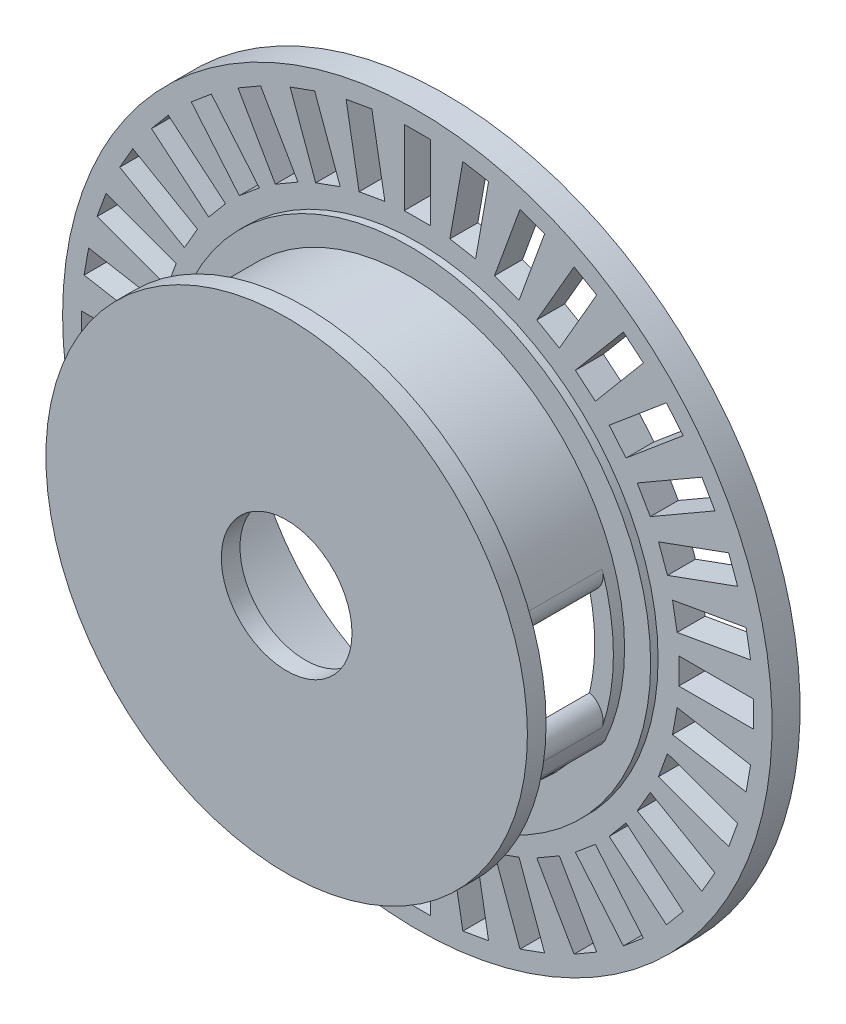
from build123d import *

# Parameters (mm, degrees)
SKETCH1_R               = 19
SKETCH1_R_2             = 3.4
SKETCH1_W               = 1.4
SKETCH1_H               = 4
SKETCH1_W_2             = 4
SKETCH1_H_2             = 1.4
BOSS_EXTRUDE1_DEPTH     = 1.5
SKETCH3_R               = 11.5
SKETCH3_R_2             = 3.4
BOSS_EXTRUDE3_DEPTH     = 1
BOSS_EXTRUDE4_DEPTH     = 6
CUT_EXTRUDE1_DEPTH      = 5
FILLET1_R               = 1
CUT_EXTRUDE2_DEPTH      = 4
CUT_EXTRUDE2_DEPTH_BACK = 22
SKETCH6_R               = 0.75
FILLET2_R               = 1
SKETCH10_W              = 2
SKETCH10_H              = 1
SKETCH15_R              = 10.5
CUT_EXTRUDE8_DEPTH      = 20
SKETCH16_R              = 19
CUT_EXTRUDE9_DEPTH      = 12.2
SKETCH18_W              = 4.7
SKETCH18_H              = 4.8
SKETCH18_W_2            = 4.9999
SKETCH18_H_2            = 1.857328015
CUT_EXTRUDE10_DEPTH     = 18
SKETCH20_R              = 12.8947325
SKETCH20_R_2            = 3.5
BOSS_EXTRUDE5_DEPTH     = 1


with BuildPart() as part:
    # Sketch1 → Boss-Extrude1 (new body)
    with BuildSketch(Plane.XY):
        Circle(SKETCH1_R)
        Circle(SKETCH1_R_2, mode=Mode.SUBTRACT)
        Polygon((3.120439914, 13.665754818), (1.74170906, 13.908862267), (2.436301771, 17.848093279), (3.815032625, 17.60498583), align=None, mode=Mode.SUBTRACT)
        with Locations((0, 16)):
            Rectangle(SKETCH1_W, SKETCH1_H, mode=Mode.SUBTRACT)
        Polygon((5.446066841, 12.916282591), (4.130497172, 13.395110791), (5.498577745, 17.153881274), (6.814147414, 16.675053074), align=None, mode=Mode.SUBTRACT)
        Polygon((7.606217783, 11.774355653), (6.393782217, 12.474355653), (8.393782217, 15.938457268), (9.606217783, 15.238457268), align=None, mode=Mode.SUBTRACT)
        Polygon((9.535257646, 10.274670877), (8.462795425, 11.17457353), (11.033945864, 14.238751303), (12.106408085, 13.338848649), align=None, mode=Mode.SUBTRACT)
        Polygon((11.17457353, 8.462795425), (10.274670877, 9.535257646), (13.338848649, 12.106408085), (14.238751303, 11.033945864), align=None, mode=Mode.SUBTRACT)
        Polygon((12.474355653, 6.393782217), (11.774355653, 7.606217783), (15.238457268, 9.606217783), (15.938457268, 8.393782217), align=None, mode=Mode.SUBTRACT)
        Polygon((13.395110791, 4.130497172), (12.916282591, 5.446066841), (16.675053074, 6.814147414), (17.153881274, 5.498577745), align=None, mode=Mode.SUBTRACT)
        Polygon((13.908862267, 1.74170906), (13.665754818, 3.120439914), (17.60498583, 3.815032625), (17.848093279, 2.436301771), align=None, mode=Mode.SUBTRACT)
        with Locations((16, 0)):
            Rectangle(SKETCH1_W_2, SKETCH1_H_2, mode=Mode.SUBTRACT)
        Polygon((13.665754818, -3.120439914), (13.908862267, -1.74170906), (17.848093279, -2.436301771), (17.60498583, -3.815032625), align=None, mode=Mode.SUBTRACT)
        Polygon((12.916282591, -5.446066841), (13.395110791, -4.130497172), (17.153881274, -5.498577745), (16.675053074, -6.814147414), align=None, mode=Mode.SUBTRACT)
        Polygon((11.774355653, -7.606217783), (12.474355653, -6.393782217), (15.938457268, -8.393782217), (15.238457268, -9.606217783), align=None, mode=Mode.SUBTRACT)
        Polygon((10.274670877, -9.535257646), (11.17457353, -8.462795425), (14.238751303, -11.033945864), (13.338848649, -12.106408085), align=None, mode=Mode.SUBTRACT)
        Polygon((8.462795425, -11.17457353), (9.535257646, -10.274670877), (12.106408085, -13.338848649), (11.033945864, -14.238751303), align=None, mode=Mode.SUBTRACT)
        Polygon((6.393782217, -12.474355653), (7.606217783, -11.774355653), (9.606217783, -15.238457268), (8.393782217, -15.938457268), align=None, mode=Mode.SUBTRACT)
        Polygon((4.130497172, -13.395110791), (5.446066841, -12.916282591), (6.814147414, -16.675053074), (5.498577745, -17.153881274), align=None, mode=Mode.SUBTRACT)
        Polygon((1.74170906, -13.908862267), (3.120439914, -13.665754818), (3.815032625, -17.60498583), (2.436301771, -17.848093279), align=None, mode=Mode.SUBTRACT)
        with Locations((0, -16)):
            Rectangle(SKETCH1_W, SKETCH1_H, mode=Mode.SUBTRACT)
        Polygon((-3.120439914, -13.665754818), (-1.74170906, -13.908862267), (-2.436301771, -17.848093279), (-3.815032625, -17.60498583), align=None, mode=Mode.SUBTRACT)
        Polygon((-5.446066841, -12.916282591), (-4.130497172, -13.395110791), (-5.498577745, -17.153881274), (-6.814147414, -16.675053074), align=None, mode=Mode.SUBTRACT)
        Polygon((-7.606217783, -11.774355653), (-6.393782217, -12.474355653), (-8.393782217, -15.938457268), (-9.606217783, -15.238457268), align=None, mode=Mode.SUBTRACT)
        Polygon((-9.535257646, -10.274670877), (-8.462795425, -11.17457353), (-11.033945864, -14.238751303), (-12.106408085, -13.338848649), align=None, mode=Mode.SUBTRACT)
        Polygon((-11.17457353, -8.462795425), (-10.274670877, -9.535257646), (-13.338848649, -12.106408085), (-14.238751303, -11.033945864), align=None, mode=Mode.SUBTRACT)
        Polygon((-12.474355653, -6.393782217), (-11.774355653, -7.606217783), (-15.238457268, -9.606217783), (-15.938457268, -8.393782217), align=None, mode=Mode.SUBTRACT)
        Polygon((-13.395110791, -4.130497172), (-12.916282591, -5.446066841), (-16.675053074, -6.814147414), (-17.153881274, -5.498577745), align=None, mode=Mode.SUBTRACT)
        Polygon((-13.908862267, -1.74170906), (-13.665754818, -3.120439914), (-17.60498583, -3.815032625), (-17.848093279, -2.436301771), align=None, mode=Mode.SUBTRACT)
        with Locations((-16, 0)):
            Rectangle(SKETCH1_W_2, SKETCH1_H_2, mode=Mode.SUBTRACT)
        Polygon((-13.665754818, 3.120439914), (-13.908862267, 1.74170906), (-17.848093279, 2.436301771), (-17.60498583, 3.815032625), align=None, mode=Mode.SUBTRACT)
        Polygon((-12.916282591, 5.446066841), (-13.395110791, 4.130497172), (-17.153881274, 5.498577745), (-16.675053074, 6.814147414), align=None, mode=Mode.SUBTRACT)
        Polygon((-11.774355653, 7.606217783), (-12.474355653, 6.393782217), (-15.938457268, 8.393782217), (-15.238457268, 9.606217783), align=None, mode=Mode.SUBTRACT)
        Polygon((-10.274670877, 9.535257646), (-11.17457353, 8.462795425), (-14.238751303, 11.033945864), (-13.338848649, 12.106408085), align=None, mode=Mode.SUBTRACT)
        Polygon((-8.462795425, 11.17457353), (-9.535257646, 10.274670877), (-12.106408085, 13.338848649), (-11.033945864, 14.238751303), align=None, mode=Mode.SUBTRACT)
        Polygon((-6.393782217, 12.474355653), (-7.606217783, 11.774355653), (-9.606217783, 15.238457268), (-8.393782217, 15.938457268), align=None, mode=Mode.SUBTRACT)
        Polygon((-4.130497172, 13.395110791), (-5.446066841, 12.916282591), (-6.814147414, 16.675053074), (-5.498577745, 17.153881274), align=None, mode=Mode.SUBTRACT)
        Polygon((-1.74170906, 13.908862267), (-3.120439914, 13.665754818), (-3.815032625, 17.60498583), (-2.436301771, 17.848093279), align=None, mode=Mode.SUBTRACT)
    extrude(amount=BOSS_EXTRUDE1_DEPTH)

    # Sketch3 → Boss-Extrude3 (add)
    with BuildSketch(Plane.XY.offset(1.5)):
        Circle(SKETCH3_R)
        Circle(SKETCH3_R_2, mode=Mode.SUBTRACT)
    extrude(amount=BOSS_EXTRUDE3_DEPTH)

    # Sketch4 → Boss-Extrude4 (add)
    with BuildSketch(Plane.XY.offset(2.5)):
        with BuildLine():
            Line((11.246777316, -2.4), (10.222035022, -2.4))
            ThreePointArc((10.222035022, -2.4), (-10.5, 0), (10.222035022, 2.4))
            Line((10.222035022, 2.4), (11.246777316, 2.4))
            ThreePointArc((11.246777316, 2.4), (-11.5, 0), (11.246777316, -2.4))
        make_face()
    extrude(amount=BOSS_EXTRUDE4_DEPTH)

    # Sketch5 → Cut-Extrude1 (cut)
    with BuildSketch(Plane.XY.offset(1.5)):
        with BuildLine():
            Line((11.691342951, -6.75), (9.09326674, -5.25))
            ThreePointArc((9.09326674, -5.25), (6.62136247, -8.149083325), (3.277720856, -9.975296787))
            Line((3.277720856, -9.975296787), (6.496874512, -11.833876017))
            ThreePointArc((6.496874512, -11.833876017), (9.442683012, -9.648095022), (11.691342951, -6.75))
        make_face()
    extrude(amount=CUT_EXTRUDE1_DEPTH, mode=Mode.SUBTRACT)

    # Fillet1
    # the kernel refuses this fillet: 1 mm, written as the material it takes off along each edge
    with BuildSketch(Plane(origin=(11.246777316, 2.4, 2.5), x_dir=(-0.26486372302858857, 0.9642858539994431, 0), z_dir=(0, 0, 1))) as fillet1_piece_1:
        with BuildLine():
            CenterArc((1.271365198, 0.9983288), FILLET1_R, 180.583527639, 92.729402637)
            Line((0.271417059, 0.988144498), (0.251418096, 0.987940812))
            ThreePointArc((0.251418096, 0.987940812), (0.116422812, 0.499369523), (-0.019285717, 0.005297274))
            Line((-0.019285717, 0.005297274), (-0.001155787, -0.019966576))
            ThreePointArc((-0.001155787, -0.019966576), (0.664577262, -0.039218796), (1.330310311, -0.019966576))
            Line((1.330310311, -0.019966576), (1.329154525, 0))
        make_face()
    extrude(amount=9.322886312, mode=Mode.SUBTRACT)
    with BuildSketch(Plane(origin=(11.246777316, -2.4, 2.5), x_dir=(-0.264863723028591, -0.9642858539994424, 0), z_dir=(0, 0, 1))) as fillet1_piece_2:
        with BuildLine():
            CenterArc((1.271365198, -0.9983288), FILLET1_R, 86.687069724, 92.729402637)
            Line((0.271417059, -0.988144498), (0.251418096, -0.987940812))
            ThreePointArc((0.251418096, -0.987940812), (0.116422812, -0.499369523), (-0.019285717, -0.005297274))
            Line((-0.019285717, -0.005297274), (-0.001155787, 0.019966576))
            ThreePointArc((-0.001155787, 0.019966576), (0.664577262, 0.039218796), (1.330310311, 0.019966576))
            Line((1.330310311, 0.019966576), (1.329154525, 0))
        make_face()
    extrude(amount=9.322886312, mode=Mode.SUBTRACT)

    # Sketch6 → Cut-Extrude2 (cut, two sides: drawn at the far end of the back side and taken through both)
    with BuildSketch(Plane(origin=(0, 0, 0), x_dir=(0, 0, -1), z_dir=(1, 0, 0)).offset(-CUT_EXTRUDE2_DEPTH_BACK)):
        with Locations(Location((-4.163799813, 0, 0), (0, 0, 180))):
            Circle(SKETCH6_R)
    extrude(amount=CUT_EXTRUDE2_DEPTH + CUT_EXTRUDE2_DEPTH_BACK, mode=Mode.SUBTRACT)

    # Fillet2
    # the kernel refuses this fillet: 1 mm, written as the material it takes off along each edge
    with BuildSketch(Plane(origin=(9.959292144, -5.75, 6.5), x_dir=(0.45819347990081116, 0.888852482123094, 0), z_dir=(0, 0, -1))) as fillet2_piece_1:
        with BuildLine():
            CenterArc((1.047619048, -0.99886557), FILLET2_R, 87.270597363, 92.729402637)
            Line((0.047619048, -0.99886557), (0.027619048, -0.99886557))
            ThreePointArc((0.027619048, -0.99886557), (0.003832212, -0.500385166), (-0.019977311, -0.000952381))
            Line((-0.019977311, -0.000952381), (-0.000952381, 0.019977311))
            ThreePointArc((-0.000952381, 0.019977311), (0.547619048, 0.033045949), (1.096190476, 0.019977311))
            Line((1.096190476, 0.019977311), (1.095238095, 0))
        make_face()
    extrude(amount=5, mode=Mode.SUBTRACT)

    # Sketch10 → Revolve1 (revolve)
    with BuildSketch(Plane(origin=(0, 0, 0), x_dir=(1, 0, 0), z_dir=(0, 1, 0))):
        with Locations((11.8947325, -1.4002)):
            Rectangle(SKETCH10_W, SKETCH10_H)
        with Locations((11.8947325, -8)):
            Rectangle(SKETCH10_W, SKETCH10_H)
    revolve(axis=Axis((0, 0, 0), (0, 0, -1)))

    # Mirror3: part across plane


with BuildPart() as part_1:
    add(part.part)
    add(part.part.mirror(Plane.XY))

    # Sketch15 → Cut-Extrude8 (cut)
    with BuildSketch(Plane.XY.offset(8.5)):
        with Locations(Location((0, 0, 0), (0, 0, 346.78701964))):
            Circle(SKETCH15_R)
    extrude(amount=-CUT_EXTRUDE8_DEPTH, mode=Mode.SUBTRACT)

    # Sketch16 → Cut-Extrude9 (cut)
    with BuildSketch(Plane.XY):
        Circle(SKETCH16_R)
    extrude(amount=-CUT_EXTRUDE9_DEPTH, mode=Mode.SUBTRACT)

    # Sketch18 → Cut-Extrude10 (cut)
    with BuildSketch(Plane(origin=(0, 0, 0), x_dir=(0, 0, -1), z_dir=(1, 0, 0))):
        with Locations((-4.85, 0)):
            Rectangle(SKETCH18_W, SKETCH18_H)
        with Locations((-4.70005, -6.289811526)):
            Rectangle(SKETCH18_W_2, SKETCH18_H_2)
    extrude(amount=CUT_EXTRUDE10_DEPTH, mode=Mode.SUBTRACT)

    # Sketch20 → Boss-Extrude5 (add)
    with BuildSketch(Plane.XY.offset(8.5)):
        Circle(SKETCH20_R)
        Circle(SKETCH20_R_2, mode=Mode.SUBTRACT)
    extrude(amount=-BOSS_EXTRUDE5_DEPTH)


solid = part_1.part
